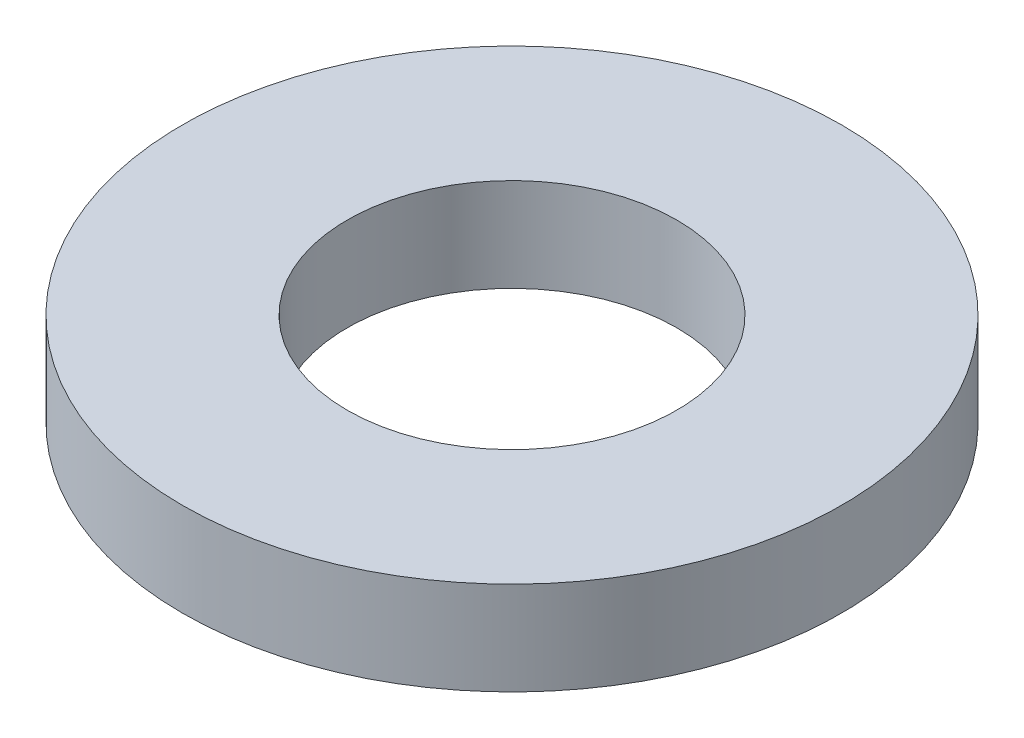
from build123d import *

# Parameters (mm, degrees)
SKETCH1_R           = 60
BOSS_EXTRUDE1_DEPTH = 17
SKETCH2_R           = 30
CUT_EXTRUDE1_DEPTH  = 87.539008545


with BuildPart() as part:
    # Sketch1 → Boss-Extrude1 (new body)
    with BuildSketch(Plane(origin=(0, 0, 0), x_dir=(1, 0, 0), z_dir=(0, 1, 0))):
        Circle(SKETCH1_R)
    extrude(amount=BOSS_EXTRUDE1_DEPTH)

    # Sketch2 → Cut-Extrude1 (cut, through all)
    with BuildSketch(Plane(origin=(0, 0, 0), x_dir=(1, 0, 0), z_dir=(0, 1, 0))):
        Circle(SKETCH2_R)
    extrude(amount=CUT_EXTRUDE1_DEPTH, mode=Mode.SUBTRACT)


solid = part.part
